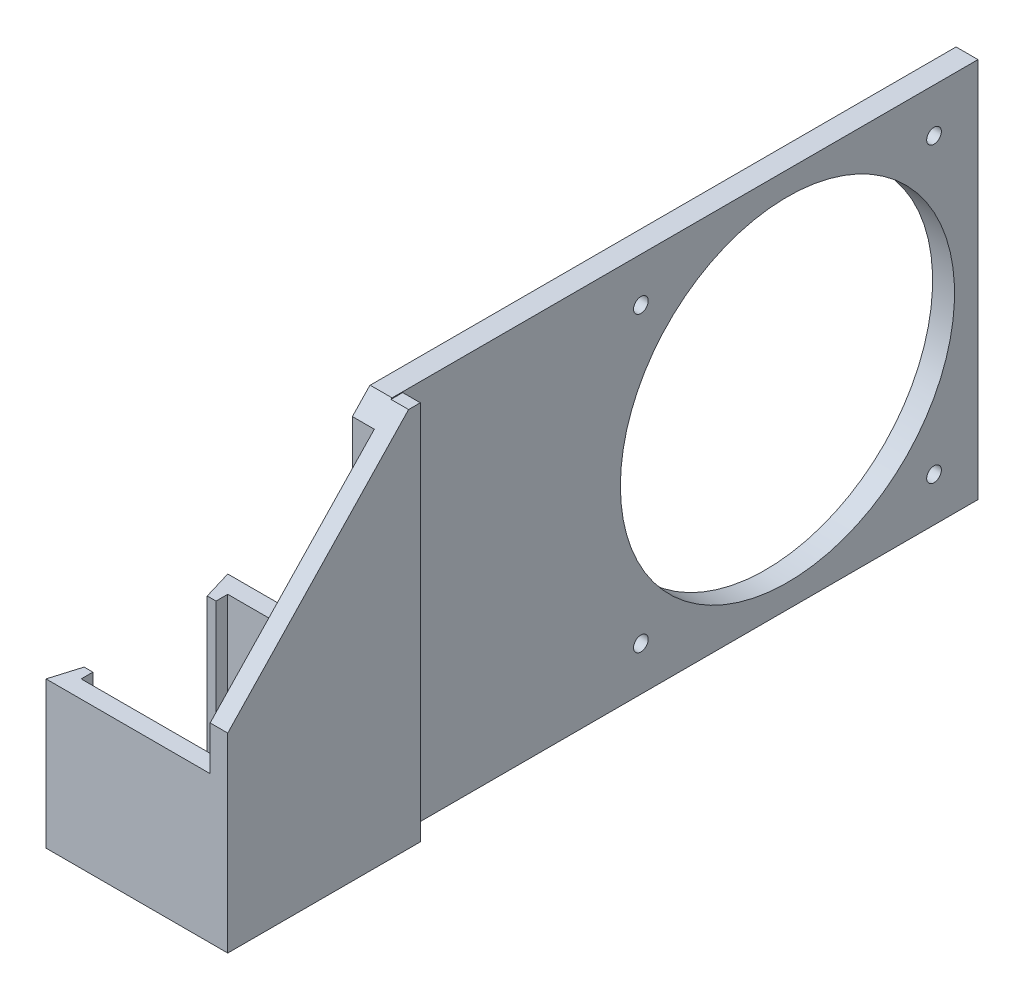
from build123d import *
from build123d.topology import SkipClean

# Parameters (mm, degrees)
EXTRUDE_1_DEPTH      = 25
CUT_EXTRUDE_4_DEPTH  = 80.457942189
SKETCH_7_W           = 16.60831278
SKETCH_7_H           = 38.473598513
CUT_EXTRUDE_14_DEPTH = 80.457942189
SKETCH_8_W           = 5
SKETCH_8_H           = 30.968526609
EXTRUDE_2_DEPTH      = 25
SKETCH_9_W           = 2.765387297
SKETCH_9_H           = 65
EXTRUDE_3_DEPTH      = 100
SKETCH_10_W          = 5.026813651
SKETCH_10_H          = 30.968526609
EXTRUDE_4_DEPTH      = 40
CUT_EXTRUDE_15_DEPTH = 100
SKETCH_12_R          = 28.5
CUT_EXTRUDE_16_DEPTH = 100
SKETCH_13_R          = 1.25
CUT_EXTRUDE_17_DEPTH = 100
SKETCH_14_W          = 5.026813651
SKETCH_14_H          = 100.124810737
CUT_EXTRUDE_19_DEPTH = 165.009199789
SKETCH_15_W          = 2.026813651
SKETCH_15_H          = 30.843715872
CUT_EXTRUDE_20_DEPTH = 165.009199789
SKETCH_16_W          = 99.968526609
SKETCH_16_H          = 65
SKETCH_16_R          = 28.5
SKETCH_16_R_2        = 1.25
EXTRUDE_5_DEPTH      = 3
EXTRUDE_7_REACH      = 157.801
SKETCH_17_W          = 3.738573646
SKETCH_17_H          = 3
CHAMFER_1_DEPTH      = 25
SKETCH_18_W          = 3
SKETCH_18_H          = 64.869017051
EXTRUDE_8_DEPTH      = 2


with BuildPart() as part:
    # Эскиз1 → Бобышка-Вытянуть1 (new body)
    with BuildSketch(Plane(origin=(0, 0, 0), x_dir=(1, 0, 0), z_dir=(0, 1, 0))):
        Polygon((-66.825757576, 34.969739794), (-66.825757576, 29.969739794), (-63.825757576, 29.969739794), (-63.825757576, 31.969739794), (-38.825757576, 31.969739794), (-38.825757576, 6.969739794), (-63.825757576, 6.969739794), (-63.825757576, 8.969739794), (-66.825757576, 8.969739794), (-66.825757576, 3.969739794), (-22.123470102, 3.969739794), (-36.579007505, 34.969739794), align=None)
    extrude(amount=EXTRUDE_1_DEPTH)

    # Эскиз3 → Вырез-Вытянуть4 (cut, through all)
    with BuildSketch(Plane.XZ):
        Polygon((-66.825757576, -3.969739794), (-65.325757576, -8.969739794), (-66.825757576, -8.969739794), align=None)
        Polygon((-66.825757576, -29.969739794), (-66.825757576, -34.969739794), (-65.325757576, -29.969739794), align=None)
    extrude(amount=-CUT_EXTRUDE_4_DEPTH, mode=Mode.SUBTRACT)

    # Эскиз7 → Вырез-Вытянуть14 (cut, through all)
    with BuildSketch(Plane(origin=(0, 0, 0), x_dir=(-1, 0, 0), z_dir=(0, -1, 0))):
        with Locations((27.703474463, 20.539743139)):
            Rectangle(SKETCH_7_W, SKETCH_7_H)
    extrude(amount=-CUT_EXTRUDE_14_DEPTH, mode=Mode.SUBTRACT)

    # Эскиз8 → Бобышка-Вытянуть2 (add)
    with BuildSketch(Plane(origin=(0, 0, 0), x_dir=(-1, 0, 0), z_dir=(0, -1, 0))):
        with Locations((36.298943925, 19.454003098)):
            Rectangle(SKETCH_8_W, SKETCH_8_H)
    extrude(amount=-EXTRUDE_2_DEPTH)

    # Эскиз9 → Бобышка-Вытянуть3 (add)
    with BuildSketch(Plane(origin=(0, 0, -34.938266403), x_dir=(-1, 0, 0), z_dir=(0, 0, -1))):
        with Locations((38.181637573, 32.5)):
            Rectangle(SKETCH_9_W, SKETCH_9_H)
    extrude(amount=EXTRUDE_3_DEPTH)

    # Эскиз10 → Бобышка-Вытянуть4 (add)
    with BuildSketch(Plane(origin=(0, 25, 0), x_dir=(1, 0, 0), z_dir=(0, 1, 0))):
        with Locations((-36.312350751, 19.454003098)):
            Rectangle(SKETCH_10_W, SKETCH_10_H)
    extrude(amount=EXTRUDE_4_DEPTH)

    # Эскиз11 → Вырез-Вытянуть15 (cut)
    with BuildSketch(Plane(origin=(-33.798943925, 0, 0), x_dir=(0, 0, -1), z_dir=(1, 0, 0))):
        Polygon((34.938266403, 65), (3.969739794, 32.5), (3.969739794, 65), align=None)
    extrude(amount=-CUT_EXTRUDE_15_DEPTH, mode=Mode.SUBTRACT)

    # Эскиз12 → Вырез-Вытянуть16 (cut)
    with BuildSketch(Plane(origin=(-36.798943925, 0, 0), x_dir=(0, 0, -1), z_dir=(1, 0, 0))):
        with Locations((102.438266403, 32.5)):
            Circle(SKETCH_12_R)
    extrude(amount=-CUT_EXTRUDE_16_DEPTH, mode=Mode.SUBTRACT)

    # Эскиз13 → Вырез-Вытянуть17 (cut)
    with BuildSketch(Plane(origin=(-36.798943925, 0, 0), x_dir=(0, 0, -1), z_dir=(1, 0, 0))):
        with Locations((77.438266403, 57.5)):
            Circle(SKETCH_13_R)
        with Locations((127.438266403, 57.5)):
            Circle(SKETCH_13_R)
        with Locations((127.438266403, 7.5)):
            Circle(SKETCH_13_R)
        with Locations((77.438266403, 7.5)):
            Circle(SKETCH_13_R)
    extrude(amount=-CUT_EXTRUDE_17_DEPTH, mode=Mode.SUBTRACT)

    # Эскиз14 → Вырез-Вытянуть19 (cut, through all)
    with BuildSketch(Plane(origin=(0, 0, 0), x_dir=(-1, 0, 0), z_dir=(0, -1, 0))):
        with Locations((36.312350751, 84.875861035)):
            Rectangle(SKETCH_14_W, SKETCH_14_H)
    extrude(amount=-CUT_EXTRUDE_19_DEPTH, mode=Mode.SUBTRACT)

    # Эскиз15 → Вырез-Вытянуть20 (cut, through all)
    with BuildSketch(Plane.XZ):
        with Locations((-34.812350751, -19.39159773)):
            Rectangle(SKETCH_15_W, SKETCH_15_H)
    extrude(amount=-CUT_EXTRUDE_20_DEPTH, mode=Mode.SUBTRACT)

    # Эскиз16 → Бобышка-Вытянуть5 (add)
    with SkipClean():  # the faces are left unmerged after this step: merging them gives an invalid solid
        with BuildSketch(Plane.ZY.offset(39.564331222)):
            with Locations((-84.954003098, 32.5)):
                Rectangle(SKETCH_16_W, SKETCH_16_H)
            with Locations((-102.438266403, 32.5)):
                Circle(SKETCH_16_R, mode=Mode.SUBTRACT)
            with Locations((-127.438266403, 57.5)):
                Circle(SKETCH_16_R_2, mode=Mode.SUBTRACT)
            with Locations((-77.438266403, 57.5)):
                Circle(SKETCH_16_R_2, mode=Mode.SUBTRACT)
            with Locations((-77.438266403, 7.5)):
                Circle(SKETCH_16_R_2, mode=Mode.SUBTRACT)
            with Locations((-127.438266403, 7.5)):
                Circle(SKETCH_16_R_2, mode=Mode.SUBTRACT)
        extrude(amount=EXTRUDE_5_DEPTH)

    # Бобышка-Вытянуть7: up to this plane
    with SkipClean():  # the faces are left unmerged after this step: merging them gives an invalid solid
        extrude_7_end = Plane(origin=(-133.798943925, 65, -34.938266403), z_dir=(0, -0.6898437432956686, -0.7239582928842101))
        # Эскиз17 → Бобышка-Вытянуть7 (add, up to the surface)
        with BuildSketch(Plane(origin=(0, 25, 0), x_dir=(1, 0, 0), z_dir=(0, 1, 0)), mode=Mode.PRIVATE) as extrude_7_sk1:
            with Locations((-40.695044399, 33.469739794)):
                Rectangle(SKETCH_17_W, SKETCH_17_H)
        extrude_7_tool1 = split(extrude(extrude_7_sk1.sketch, amount=EXTRUDE_7_REACH, mode=Mode.PRIVATE), bisect_by=extrude_7_end, keep=Keep.BOTH, mode=Mode.PRIVATE)
        add(extrude_7_tool1.solids().sort_by_distance((-40.695044, 25, -33.46974))[0])

    # Фаска1: read off the stored shape, not the designer's step
    # Фаска1 outline → Фаска1 (add)
    with SkipClean():  # the faces are left unmerged after this step: merging them gives an invalid solid
        with BuildSketch(Plane(origin=(0, 0, 0), x_dir=(1, 0, 0), z_dir=(0, 1, 0))):
            Polygon((-42.564331222, 44.969739794), (-52.564331222, 34.969739794), (-42.564331222, 34.969739794), align=None)
        extrude(amount=CHAMFER_1_DEPTH)

    # Эскиз18 → Бобышка-Вытянуть8 (add)
    with SkipClean():  # the faces are left unmerged after this step: merging them gives an invalid solid
        with BuildSketch(Plane(origin=(0, 0, -34.813455666), x_dir=(-1, 0, 0), z_dir=(0, 0, -1))):
            with Locations((37.325757576, 32.434508526)):
                Rectangle(SKETCH_18_W, SKETCH_18_H)
        extrude(amount=EXTRUDE_8_DEPTH)


solid = part.part
